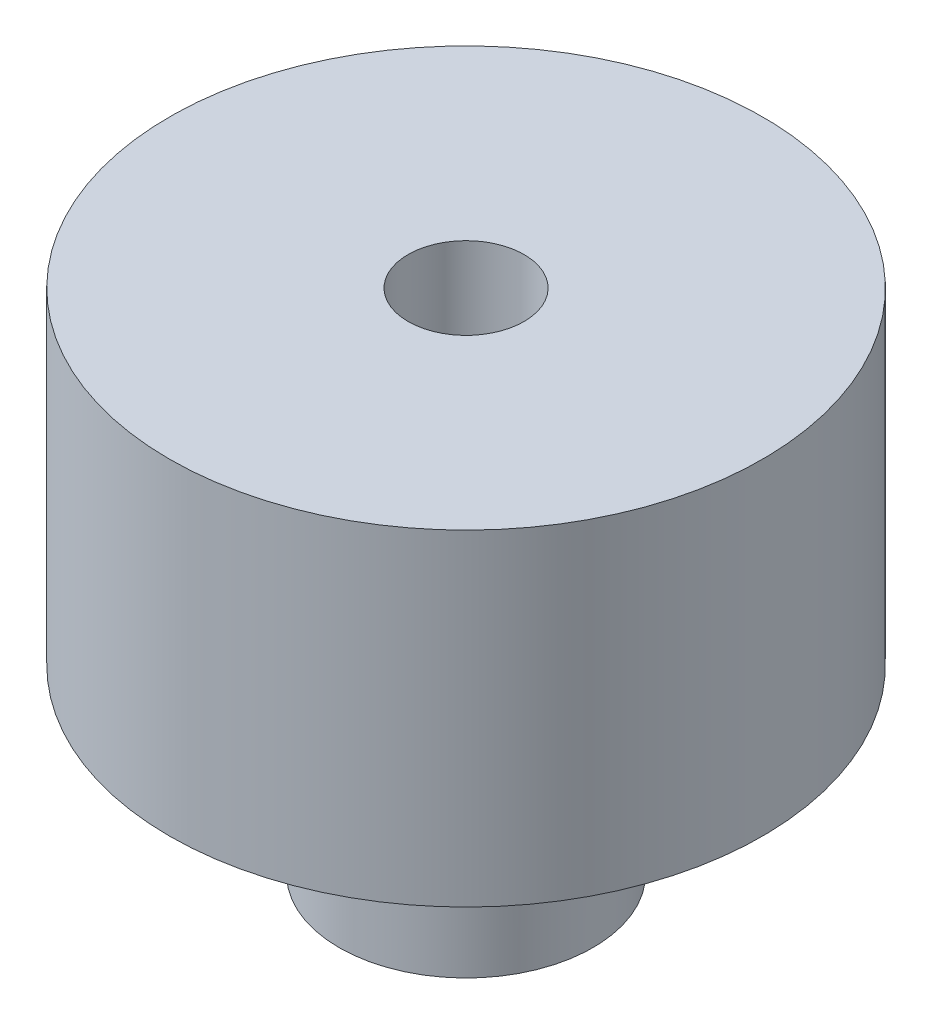
from build123d import *

# Parameters (mm, degrees)
BOSS_EXTRUDE1_DEPTH      = 6
BOSS_EXTRUDE1_DEPTH_BACK = 3
SKETCH1_R                = 8.175
SKETCH1_R_2              = 1.6
SKETCH1_3_R              = 8.175
SKETCH1_3_R_2            = 1.6
BOSS_EXTRUDE2_DEPTH      = 3
SKETCH2_R                = 1
CUT_EXTRUDE1_DEPTH       = 15
SKETCH4_R                = 3.5
BOSS_EXTRUDE3_DEPTH      = 5
SKETCH1_7_R              = 1.6
CUT_EXTRUDE2_DEPTH       = 13


with BuildPart() as part:
    # Sketch1 → Boss-Extrude1 (new, two sides: drawn at the far end of the back side and taken through both)
    with BuildSketch(Plane(origin=(0, 0, 0), x_dir=(1, 0, 0), z_dir=(0, 1, 0)).offset(-BOSS_EXTRUDE1_DEPTH_BACK)):
        Circle(SKETCH1_R)
        Circle(SKETCH1_R_2, mode=Mode.SUBTRACT)
    extrude(amount=BOSS_EXTRUDE1_DEPTH + BOSS_EXTRUDE1_DEPTH_BACK)

    # Sketch2 → Cut-Extrude1 (cut)
    with BuildSketch(Plane(origin=(0, 0, 0), x_dir=(0, 0, -1), z_dir=(1, 0, 0))):
        with Locations((0, 3)):
            Circle(SKETCH2_R)
    extrude(amount=-CUT_EXTRUDE1_DEPTH, mode=Mode.SUBTRACT)



with BuildPart() as body_2:
    # Sketch1<3> → Boss-Extrude2 (new body)
    with BuildSketch(Plane(origin=(0, 0, 0), x_dir=(1, 0, 0), z_dir=(0, 1, 0))):
        Circle(SKETCH1_3_R)
        Circle(SKETCH1_3_R_2, mode=Mode.SUBTRACT)
    extrude(amount=-BOSS_EXTRUDE2_DEPTH)


with BuildPart() as part_1:
    add(part.part)

    add(body_2.part)  # Boss-Extrude3 merges body 2
    # Sketch4 → Boss-Extrude3 (add)
    with BuildSketch(Plane.XZ.offset(3)):
        Circle(SKETCH4_R)
    extrude(amount=BOSS_EXTRUDE3_DEPTH)

    # Sketch1<7> → Cut-Extrude2 (cut)
    with BuildSketch(Plane(origin=(0, 0, 0), x_dir=(1, 0, 0), z_dir=(0, 1, 0))):
        Circle(SKETCH1_7_R)
    extrude(amount=-CUT_EXTRUDE2_DEPTH, mode=Mode.SUBTRACT)


solid = part_1.part
